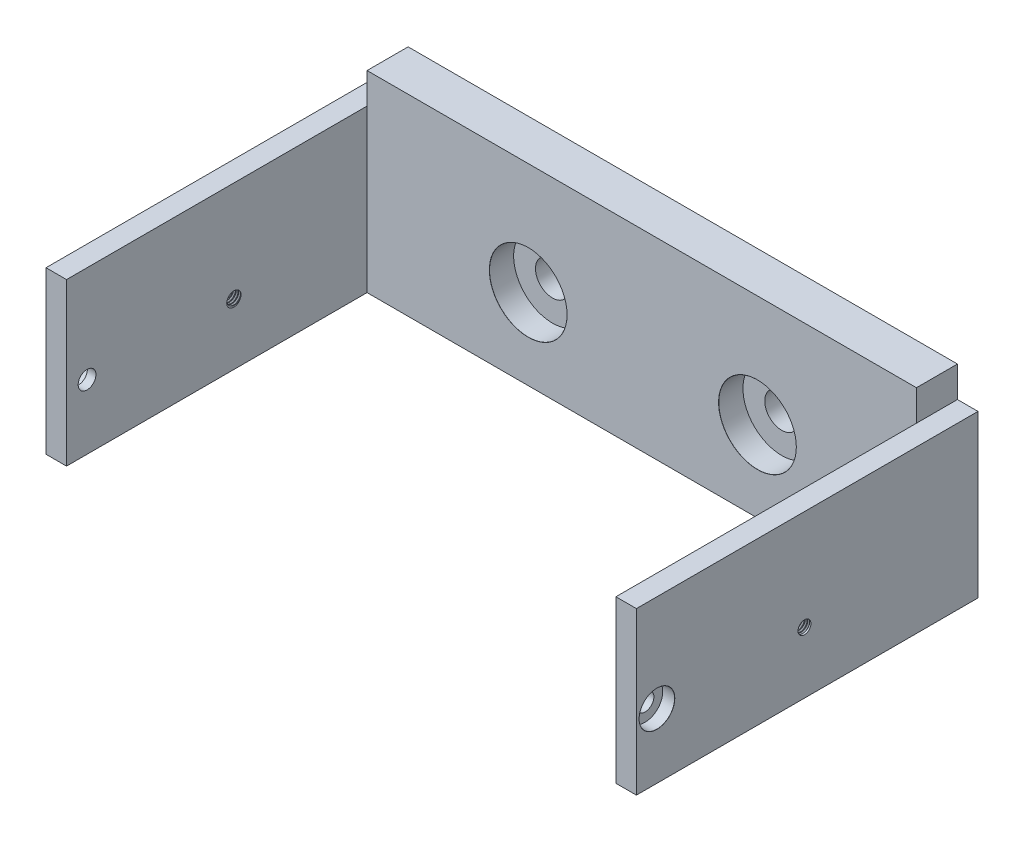
from build123d import *
from build123d.topology import SkipClean

# Parameters (mm, degrees)
ESBO_O1_W                                      = 170
ESBO_O1_H                                      = 59.52
RESSALTO_EXTRUS_O1_DEPTH                       = 12.7
ESBO_O2_W                                      = 6.35
ESBO_O2_H                                      = 50
RESSALTO_EXTRUS_O3_DEPTH                       = 105.7
ESBO_O3_R                                      = 2.5
CORTE_EXTRUS_O2_DEPTH                          = 176.35
ESBO_O11_R                                     = 5
CORTE_EXTRUS_O3_DEPTH                          = 134.714173146
REBAIXO_PARA_PARAFUSO_COM_CABE_A_PAN_2_A_COUNT = 2
REBAIXO_PARA_PARAFUSO_COM_CABE_A_PAN_2_A_PITCH = 70.94
ESBO_O14_R                                     = 2
CORTE_EXTRUS_O4_DEPTH                          = 214.160591104
ROSCA1_PITCH                                   = 0.8
ROSCA2_PITCH                                   = 0.8


with BuildPart() as part:
    # Esboço1 → Ressalto-extrusão1 (new body)
    with BuildSketch(Plane.XY):
        Rectangle(ESBO_O1_W, ESBO_O1_H)
    extrude(amount=RESSALTO_EXTRUS_O1_DEPTH)

    # Esboço2 → Ressalto-extrusão3 (add)
    with BuildSketch(Plane.XY):
        with Locations((-88.175, -4.76)):
            Rectangle(ESBO_O2_W, ESBO_O2_H)
        with Locations((88.175, -4.76)):
            Rectangle(ESBO_O2_W, ESBO_O2_H)
    extrude(amount=RESSALTO_EXTRUS_O3_DEPTH)

    # Esboço3 → Corte-extrusão2 (cut)
    with BuildSketch(Plane(origin=(91.35, 0, 0), x_dir=(0, 0, -1), z_dir=(1, 0, 0))):
        with Locations(Location((-99.35, -9.76, 0), (0, 0, 90))):
            Circle(ESBO_O3_R)
    corte_extrus_o2 = extrude(amount=-CORTE_EXTRUS_O2_DEPTH, mode=Mode.SUBTRACT)

    # Espelhar1: Corte-extrusão2 across plane
    add(corte_extrus_o2.mirror(Plane(origin=(0, 0, 0), x_dir=(0, 0, 1), z_dir=(1, 0, 0))), mode=Mode.SUBTRACT)

    # Esboço8 → Rebaixo para parafuso com cabe_a panela (revolve, cut)
    with BuildSketch(Plane(origin=(-91.35, -9.76, 99.35), x_dir=(0, 0, 1), z_dir=(0, 1, 0))):
        Polygon((0, 0), (0, 182.7), (2.75, 182.7), (2.75, 3.7), (5.5, 3.7), (5.5, 0.025), (5.525, 0), align=None)
    revolve(axis=Axis((-97.7, -9.76, 99.35), (1, 0, 0)), mode=Mode.SUBTRACT)

    # Esboço10 → Furo roscado de M52 (revolve, cut)
    with BuildSketch(Plane(origin=(91.35, -9.76, 99.35), x_dir=(0, 0, -1), z_dir=(0, 1, 0))):
        Polygon((0, 0), (0, 182.7), (2.75, 182.7), (2.75, 3.7), (5.5, 3.7), (5.5, 0.025), (5.525, 0), align=None)
    revolve(axis=Axis((97.7, -9.76, 99.35), (-1, 0, 0)), mode=Mode.SUBTRACT)

    # Esboço11 → Corte-extrusão3 (cut, through all)
    with BuildSketch(Plane.XY.offset(12.7)):
        with Locations((-35.132593285, -4.76)):
            Circle(ESBO_O11_R)
        with Locations((35.807406715, -4.76)):
            Circle(ESBO_O11_R)
    extrude(amount=-CORTE_EXTRUS_O3_DEPTH, mode=Mode.SUBTRACT)

    # Esboço13 → Rebaixo para parafuso com cabe_a pan 2 (revolve, cut)
    with BuildSketch(Plane(origin=(-35.132593285, -4.76, 12.7), x_dir=(0, -1, 0), z_dir=(1, 0, 0))):
        Polygon((0, 0), (0, 23.20451825), (5.25, 20.05), (5.25, 7.5), (12, 7.5), (12, 0.025), (12.025, 0), align=None)
    rebaixo_para_parafuso_com_cabe_a_pan_2 = revolve(axis=Axis((-35.132593285, -4.76, 19.05), (0, 0, -1)), mode=Mode.SUBTRACT)

    # Rebaixo para parafuso com cabe_a pan 2 a: Rebaixo para parafuso com cabe_a pan 2 ×2
    with Locations(*[(i * REBAIXO_PARA_PARAFUSO_COM_CABE_A_PAN_2_A_PITCH, 0, 0) for i in range(1, REBAIXO_PARA_PARAFUSO_COM_CABE_A_PAN_2_A_COUNT)]):
        add(rebaixo_para_parafuso_com_cabe_a_pan_2, mode=Mode.SUBTRACT)

    # Esboço14 → Corte-extrusão4 (cut, through all)
    with BuildSketch(Plane(origin=(91.35, 0, 0), x_dir=(0, 0, -1), z_dir=(1, 0, 0))):
        with Locations((-53.7, -10.77)):
            Circle(ESBO_O14_R)
    extrude(amount=-CORTE_EXTRUS_O4_DEPTH, mode=Mode.SUBTRACT)

    # Rosca1: the profile of Perfil da rosca1 profile screwed along a right-hand helix of 12.5 turns, 8 arcs to a turn; built about Z, then put on its axis
    with SkipClean():  # the faces are left unmerged after this step: merging them gives an invalid solid
        rosca1_z = Axis((0, 0, 0), (0, 0, 1))
        rosca1_corners = [(1.9997, 0, -0.000173205), (2.4330127, 0, 0.249999999), (2.4330127, 0, 0.349999999), (1.9997, 0, 0.600173203)]
        with BuildLine(mode=Mode.PRIVATE) as rosca1_profile:
            Line(rosca1_corners[0], rosca1_corners[1])
            Line(rosca1_corners[1], rosca1_corners[2])
            Line(rosca1_corners[2], rosca1_corners[3])
            Line(rosca1_corners[3], rosca1_corners[0])
        rosca1_cap = Face(rosca1_profile.wire())
        rosca1_turn_angles = [0, 22.5, 45, 67.5, 90, 112.5, 135, 157.5, 180, 202.5, 225, 247.5, 270, 292.5, 315, 337.5, 360]
        rosca1_turn_weights = [1, 0.9238795325112867, 1, 0.9238795325112867, 1, 0.9238795325112867, 1, 0.9238795325112867, 1, 0.9238795325112867, 1, 0.9238795325112867, 1, 0.9238795325112867, 1, 0.9238795325112867, 1]
        rosca1_turn_rails = [Edge.make_bspline([Vector(p[0], p[1], 0).rotate(rosca1_z, rosca1_turn_angles[k]) / rosca1_turn_weights[k] + Vector(0, 0, p[2] + ROSCA1_PITCH * rosca1_turn_angles[k] / 360) for k in range(17)], [0, 0, 0, 1, 1, 2, 2, 3, 3, 4, 4, 5, 5, 6, 6, 7, 7, 8, 8, 8], 2, rosca1_turn_weights) for p in rosca1_corners]
        rosca1_turn_sides = [Face.make_surface_from_curves(rosca1_turn_rails[p[0]], rosca1_turn_rails[p[1]]) for p in [(0, 1), (1, 2), (2, 3), (3, 0)]]
        rosca1_last_angles = [4320, 4342.5, 4365, 4387.5, 4410, 4432.5, 4455, 4477.5, 4500]
        rosca1_last_weights = [1, 0.9238795325112867, 1, 0.9238795325112867, 1, 0.9238795325112867, 1, 0.9238795325112867, 1]
        rosca1_last_rails = [Edge.make_bspline([Vector(p[0], p[1], 0).rotate(rosca1_z, rosca1_last_angles[k]) / rosca1_last_weights[k] + Vector(0, 0, p[2] + ROSCA1_PITCH * rosca1_last_angles[k] / 360) for k in range(9)], [0, 0, 0, 1, 1, 2, 2, 3, 3, 4, 4, 4], 2, rosca1_last_weights) for p in rosca1_corners]
        rosca1_last_sides = [Face.make_surface_from_curves(rosca1_last_rails[p[0]], rosca1_last_rails[p[1]]) for p in [(0, 1), (1, 2), (2, 3), (3, 0)]]
        rosca1 = Plane(origin=(91.35, -10.77, 53.7), x_dir=(0, 0, 1), z_dir=(-1, 0, 0)) * Solid(Shell([*[p.moved(Location((0, 0, ROSCA1_PITCH * i))) for i in range(12) for p in rosca1_turn_sides], *rosca1_last_sides, rosca1_cap, rosca1_cap.rotate(rosca1_z, 4500).moved(Location((0, 0, ROSCA1_PITCH * 4500 / 360)))]))
        add(rosca1, mode=Mode.SUBTRACT)

    # Rosca2: the profile of Perfil da rosca2 profile screwed along a right-hand helix of 12.5 turns, 8 arcs to a turn; built about Z, then put on its axis
    with SkipClean():  # the faces are left unmerged after this step: merging them gives an invalid solid
        rosca2_z = Axis((0, 0, 0), (0, 0, 1))
        rosca2_corners = [(1.9997, 0, -0.000173205), (2.4330127, 0, 0.249999999), (2.4330127, 0, 0.349999999), (1.9997, 0, 0.600173203)]
        with BuildLine(mode=Mode.PRIVATE) as rosca2_profile:
            Line(rosca2_corners[0], rosca2_corners[1])
            Line(rosca2_corners[1], rosca2_corners[2])
            Line(rosca2_corners[2], rosca2_corners[3])
            Line(rosca2_corners[3], rosca2_corners[0])
        rosca2_cap = Face(rosca2_profile.wire())
        rosca2_turn_angles = [0, 22.5, 45, 67.5, 90, 112.5, 135, 157.5, 180, 202.5, 225, 247.5, 270, 292.5, 315, 337.5, 360]
        rosca2_turn_weights = [1, 0.9238795325112867, 1, 0.9238795325112867, 1, 0.9238795325112867, 1, 0.9238795325112867, 1, 0.9238795325112867, 1, 0.9238795325112867, 1, 0.9238795325112867, 1, 0.9238795325112867, 1]
        rosca2_turn_rails = [Edge.make_bspline([Vector(p[0], p[1], 0).rotate(rosca2_z, rosca2_turn_angles[k]) / rosca2_turn_weights[k] + Vector(0, 0, p[2] + ROSCA2_PITCH * rosca2_turn_angles[k] / 360) for k in range(17)], [0, 0, 0, 1, 1, 2, 2, 3, 3, 4, 4, 5, 5, 6, 6, 7, 7, 8, 8, 8], 2, rosca2_turn_weights) for p in rosca2_corners]
        rosca2_turn_sides = [Face.make_surface_from_curves(rosca2_turn_rails[p[0]], rosca2_turn_rails[p[1]]) for p in [(0, 1), (1, 2), (2, 3), (3, 0)]]
        rosca2_last_angles = [4320, 4342.5, 4365, 4387.5, 4410, 4432.5, 4455, 4477.5, 4500]
        rosca2_last_weights = [1, 0.9238795325112867, 1, 0.9238795325112867, 1, 0.9238795325112867, 1, 0.9238795325112867, 1]
        rosca2_last_rails = [Edge.make_bspline([Vector(p[0], p[1], 0).rotate(rosca2_z, rosca2_last_angles[k]) / rosca2_last_weights[k] + Vector(0, 0, p[2] + ROSCA2_PITCH * rosca2_last_angles[k] / 360) for k in range(9)], [0, 0, 0, 1, 1, 2, 2, 3, 3, 4, 4, 4], 2, rosca2_last_weights) for p in rosca2_corners]
        rosca2_last_sides = [Face.make_surface_from_curves(rosca2_last_rails[p[0]], rosca2_last_rails[p[1]]) for p in [(0, 1), (1, 2), (2, 3), (3, 0)]]
        rosca2 = Plane(origin=(-91.35, -10.77, 53.7), x_dir=(0, 0, -1), z_dir=(1, 0, 0)) * Solid(Shell([*[p.moved(Location((0, 0, ROSCA2_PITCH * i))) for i in range(12) for p in rosca2_turn_sides], *rosca2_last_sides, rosca2_cap, rosca2_cap.rotate(rosca2_z, 4500).moved(Location((0, 0, ROSCA2_PITCH * 4500 / 360)))]))
        add(rosca2, mode=Mode.SUBTRACT)


solid = part.part
